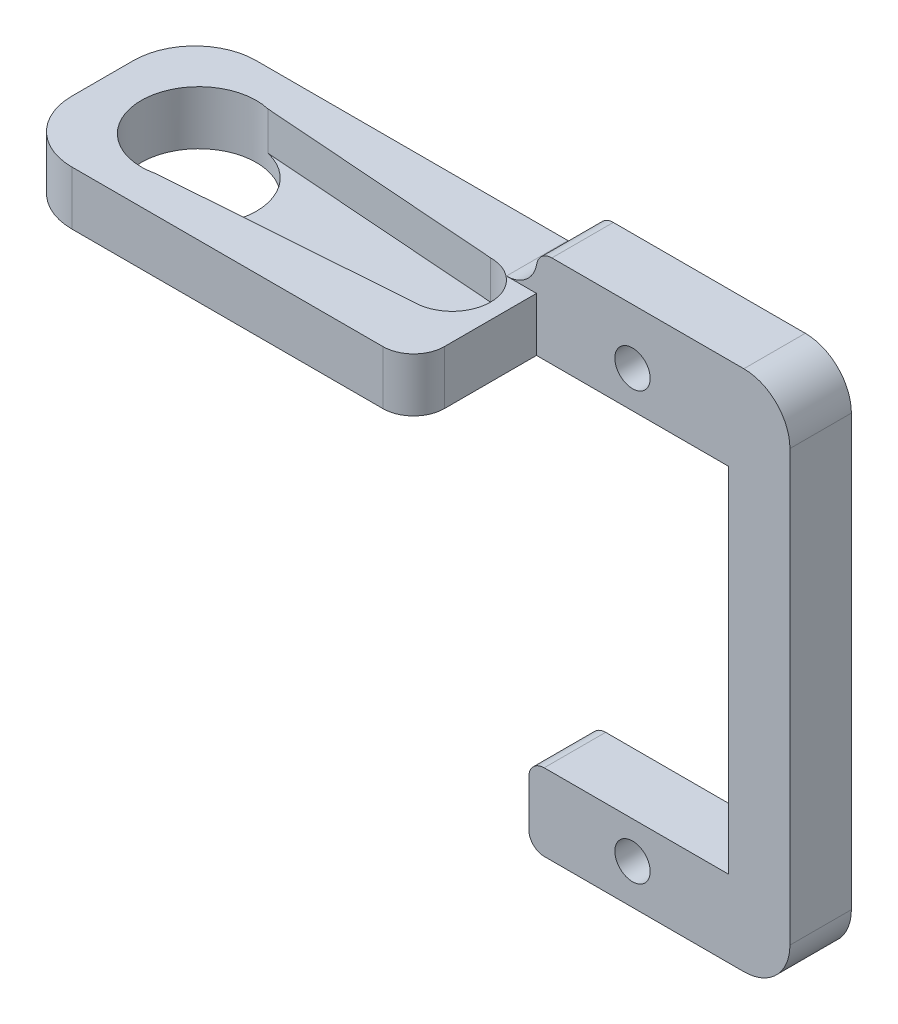
from build123d import *

# Parameters (mm, degrees)
SKETCH1_W               = 24.75
SKETCH1_H               = 12
BOSS_EXTRUDE1_DEPTH     = 3.5
SKETCH2_R               = 3.75
CUT_EXTRUDE1_DEPTH      = 15.191216474
CUT_EXTRUDE4_DEPTH      = 2.5
SKETCH5_W               = 4
SKETCH5_H               = 3.5
BOSS_EXTRUDE2_DEPTH     = 12.5
SKETCH6_W               = 4
SKETCH6_H               = 3.5
BOSS_EXTRUDE3_DEPTH     = 4
SKETCH7_W               = 4
SKETCH7_H               = 4
BOSS_EXTRUDE4_DEPTH     = 28
SKETCH8_W               = 4
SKETCH8_H               = 5
BOSS_EXTRUDE5_DEPTH     = 13
SKETCH9_W               = 16.5
SKETCH9_H               = 4
BOSS_EXTRUDE6_DEPTH     = 2.5
CUT_EXTRUDE5_DEPTH      = 42.009335827
CUT_EXTRUDE5_DEPTH_BACK = 50
SKETCH10_R              = 1.15
FILLET4_R               = 1
SKETCH13_W              = 12
SKETCH13_H              = 3.5
BOSS_EXTRUDE7_DEPTH     = 1.5
FILLET5_R               = 4
FILLET6_R               = 4
FILLET7_R               = 2
FILLET8_R               = 3
FILLET9_R               = 2


with BuildPart() as part:
    # Sketch1 → Boss-Extrude1 (new body)
    with BuildSketch(Plane(origin=(0, 0, 0), x_dir=(1, 0, 0), z_dir=(0, 1, 0))):
        Rectangle(SKETCH1_W, SKETCH1_H)
    extrude(amount=BOSS_EXTRUDE1_DEPTH)

    # Sketch2 → Cut-Extrude1 (cut, through all)
    with BuildSketch(Plane(origin=(0, 3.5, 0), x_dir=(1, 0, 0), z_dir=(0, 1, 0))):
        with Locations(Location((-7.625, 0.009358416, 0), (0, 0, 270))):
            Circle(SKETCH2_R)
    extrude(amount=-CUT_EXTRUDE1_DEPTH, mode=Mode.SUBTRACT)

    # Sketch4 → Cut-Extrude4 (cut)
    with BuildSketch(Plane(origin=(0, 3.5, 0), x_dir=(1, 0, 0), z_dir=(0, 1, 0))):
        with BuildLine():
            Line((-6.764767473, 3.659358416), (8.875, 2.509358416))
            ThreePointArc((8.875, 2.509358416), (11.375, 0.009358416), (8.875, -2.490641584))
            Line((8.875, -2.490641584), (-6.764767473, -3.640641584))
            ThreePointArc((-6.764767473, -3.640641584), (-3.875, 0.009358416), (-6.764767473, 3.659358416))
        make_face()
    extrude(amount=-CUT_EXTRUDE4_DEPTH, mode=Mode.SUBTRACT)

    # Sketch5 → Boss-Extrude2 (add)
    with BuildSketch(Plane(origin=(12.375, 0, 0), x_dir=(0, 0, -1), z_dir=(1, 0, 0))):
        with Locations((4, 1.75)):
            Rectangle(SKETCH5_W, SKETCH5_H)
    extrude(amount=BOSS_EXTRUDE2_DEPTH)

    # Sketch6 → Boss-Extrude3 (add)
    with BuildSketch(Plane(origin=(24.875, 0, 0), x_dir=(0, 0, -1), z_dir=(1, 0, 0))):
        with Locations((4, 1.75)):
            Rectangle(SKETCH6_W, SKETCH6_H)
    extrude(amount=BOSS_EXTRUDE3_DEPTH)

    # Sketch7 → Boss-Extrude4 (add)
    with BuildSketch(Plane.XZ):
        with Locations((26.875, -4)):
            Rectangle(SKETCH7_W, SKETCH7_H)
    extrude(amount=BOSS_EXTRUDE4_DEPTH)

    # Sketch8 → Boss-Extrude5 (add)
    with BuildSketch(Plane.ZY.offset(-24.875)):
        with Locations((-4, -25.5)):
            Rectangle(SKETCH8_W, SKETCH8_H)
    extrude(amount=BOSS_EXTRUDE5_DEPTH)

    # Sketch9 → Boss-Extrude6 (add)
    with BuildSketch(Plane(origin=(0, 3.5, 0), x_dir=(1, 0, 0), z_dir=(0, 1, 0))):
        with Locations((20.625, 4)):
            Rectangle(SKETCH9_W, SKETCH9_H)
    extrude(amount=BOSS_EXTRUDE6_DEPTH)

    # Sketch10 → Cut-Extrude5 (cut, two sides: drawn at the far end of the back side and taken through both)
    with BuildSketch(Plane.XY.offset(-2).offset(-CUT_EXTRUDE5_DEPTH_BACK)):
        with Locations((18.625, 2.4)):
            Circle(SKETCH10_R)
        with Locations((18.625, -25.4)):
            Circle(SKETCH10_R)
    extrude(amount=CUT_EXTRUDE5_DEPTH + CUT_EXTRUDE5_DEPTH_BACK, mode=Mode.SUBTRACT)

    # Fillet4
    fillet4_edges = [part.edges().sort_by_distance(p)[0] for p in [
        (11.875, -28, -4),
        (11.875, -23, -4),
        (12.375, 6, -4),
    ]]
    fillet(fillet4_edges, radius=FILLET4_R)

    # Sketch13 → Boss-Extrude7 (add)
    with BuildSketch(Plane.ZY.offset(12.375)):
        with Locations((0, 1.75)):
            Rectangle(SKETCH13_W, SKETCH13_H)
    extrude(amount=BOSS_EXTRUDE7_DEPTH)

    # Fillet5
    fillet5_edges = [part.edges().sort_by_distance(p)[0] for p in [
        (-13.875, 1.75, 6),
    ]]
    fillet(fillet5_edges, radius=FILLET5_R)

    # Fillet6
    fillet6_edges = [part.edges().sort_by_distance(p)[0] for p in [
        (-13.875, 1.75, -6),
    ]]
    fillet(fillet6_edges, radius=FILLET6_R)

    # Fillet7
    fillet7_edges = [part.edges().sort_by_distance(p)[0] for p in [
        (12.375, 1.75, 6),
    ]]
    fillet(fillet7_edges, radius=FILLET7_R)

    # Fillet8
    fillet8_edges = [part.edges().sort_by_distance(p)[0] for p in [
        (28.875, -28, -4),
        (28.875, 6, -4),
    ]]
    fillet(fillet8_edges, radius=FILLET8_R)

    # Fillet9
    # the kernel refuses this fillet: 2 mm, written as the material it adds along each edge
    with BuildSketch(Plane(origin=(12.375, 3.5, -6), x_dir=(0.008391726197268362, 0.9999647888458023, 0), z_dir=(0, 0, 1))) as fillet9_piece_1:
        with BuildLine():
            CenterArc((1.983498243, 1.974754399), FILLET9_R, 180.480816137, 80.405931773)
            Line((-0.016431335, 1.957970947), (-0.216424292, 1.956292601))
            Line((-0.216424292, 1.956292601), (-0.199992958, -0.001678345))
            Line((-0.199992958, -0.001678345), (0.001678345, -0.199992958))
            ThreePointArc((0.001678345, -0.199992958), (1.501625529, -0.187405368), (1.635048065, -0.19747544))
            Line((1.635048065, -0.19747544), (1.666725354, 0))
        make_face()
    extrude(amount=4)


solid = part.part
